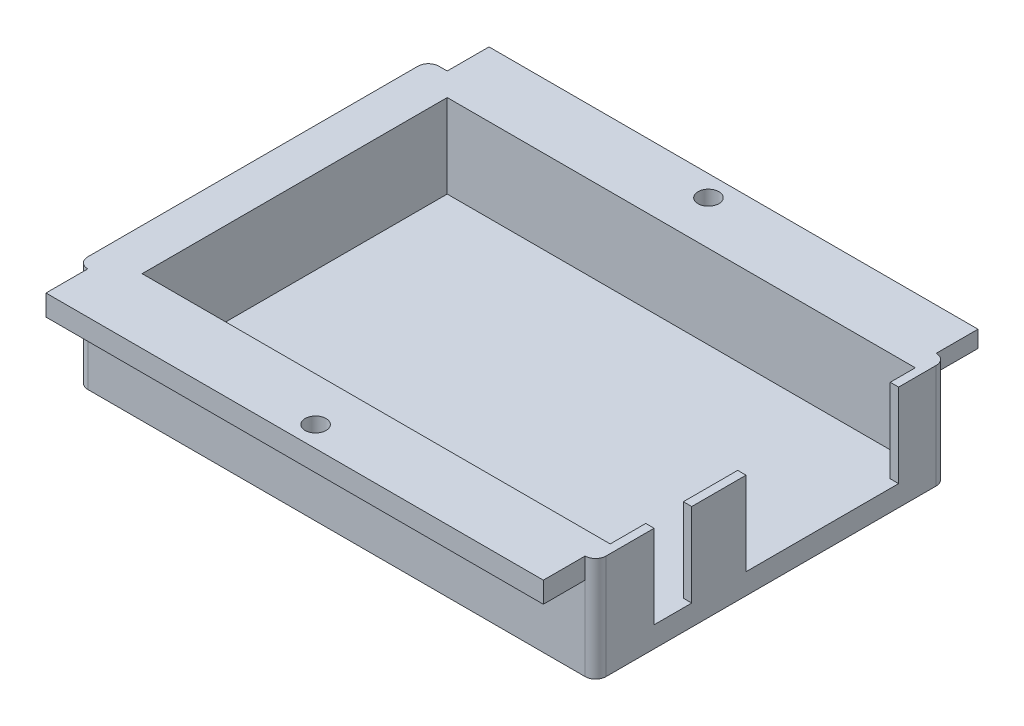
from build123d import *

# Parameters (mm, degrees)
SKETCH1_W           = 124
SKETCH1_H           = 84
BOSS_EXTRUDE1_DEPTH = 25
SKETCH2_W           = 112
SKETCH2_H           = 73
CUT_EXTRUDE1_DEPTH  = 20
SKETCH4_W           = 2
SKETCH4_H           = 9
SKETCH4_H_2         = 36.5
CUT_EXTRUDE2_DEPTH  = 20
FILLET1_R           = 2.5
SKETCH5_W           = 119
SKETCH5_H           = 5
BOSS_EXTRUDE2_DEPTH = 10
SKETCH6_W           = 117
SKETCH6_H           = 4
BOSS_EXTRUDE3_DEPTH = 10
SKETCH7_R           = 2.5
CUT_EXTRUDE3_DEPTH  = 85.693565281


with BuildPart() as part:
    # Sketch1 → Boss-Extrude1 (new body)
    with BuildSketch(Plane(origin=(0, 0, 0), x_dir=(1, 0, 0), z_dir=(0, 1, 0))):
        Rectangle(SKETCH1_W, SKETCH1_H)
    extrude(amount=BOSS_EXTRUDE1_DEPTH)

    # Sketch2 → Cut-Extrude1 (cut)
    with BuildSketch(Plane(origin=(0, 25, 0), x_dir=(1, 0, 0), z_dir=(0, 1, 0))):
        with Locations((4, 0)):
            Rectangle(SKETCH2_W, SKETCH2_H)
    extrude(amount=-CUT_EXTRUDE1_DEPTH, mode=Mode.SUBTRACT)

    # Sketch4 → Cut-Extrude2 (cut)
    with BuildSketch(Plane(origin=(0, 25, 0), x_dir=(1, 0, 0), z_dir=(0, 1, 0))):
        with Locations((61, -23.5)):
            Rectangle(SKETCH4_W, SKETCH4_H)
        with Locations((61, 12.25)):
            Rectangle(SKETCH4_W, SKETCH4_H_2)
    extrude(amount=-CUT_EXTRUDE2_DEPTH, mode=Mode.SUBTRACT)

    # Fillet1
    fillet1_edges = [part.edges().sort_by_distance(p)[0] for p in [
        (-62, 12.5, -42),
        (62, 12.5, -42),
        (62, 12.5, 42),
        (-62, 12.5, 42),
    ]]
    fillet(fillet1_edges, radius=FILLET1_R)

    # Sketch5 → Boss-Extrude2 (add)
    with BuildSketch(Plane.XY.offset(42)):
        with Locations((0, 22.5)):
            Rectangle(SKETCH5_W, SKETCH5_H)
    extrude(amount=BOSS_EXTRUDE2_DEPTH)

    # Sketch6 → Boss-Extrude3 (add)
    with BuildSketch(Plane(origin=(0, 0, -42), x_dir=(-1, 0, 0), z_dir=(0, 0, -1))):
        with Locations((-1, 23)):
            Rectangle(SKETCH6_W, SKETCH6_H)
    extrude(amount=BOSS_EXTRUDE3_DEPTH)

    # Sketch7 → Cut-Extrude3 (cut, through all)
    with BuildSketch(Plane(origin=(0, 25, 0), x_dir=(1, 0, 0), z_dir=(0, 1, 0))):
        with Locations((0, 47)):
            Circle(SKETCH7_R)
        with Locations((0, -47)):
            Circle(SKETCH7_R)
    extrude(amount=-CUT_EXTRUDE3_DEPTH, mode=Mode.SUBTRACT)


solid = part.part
